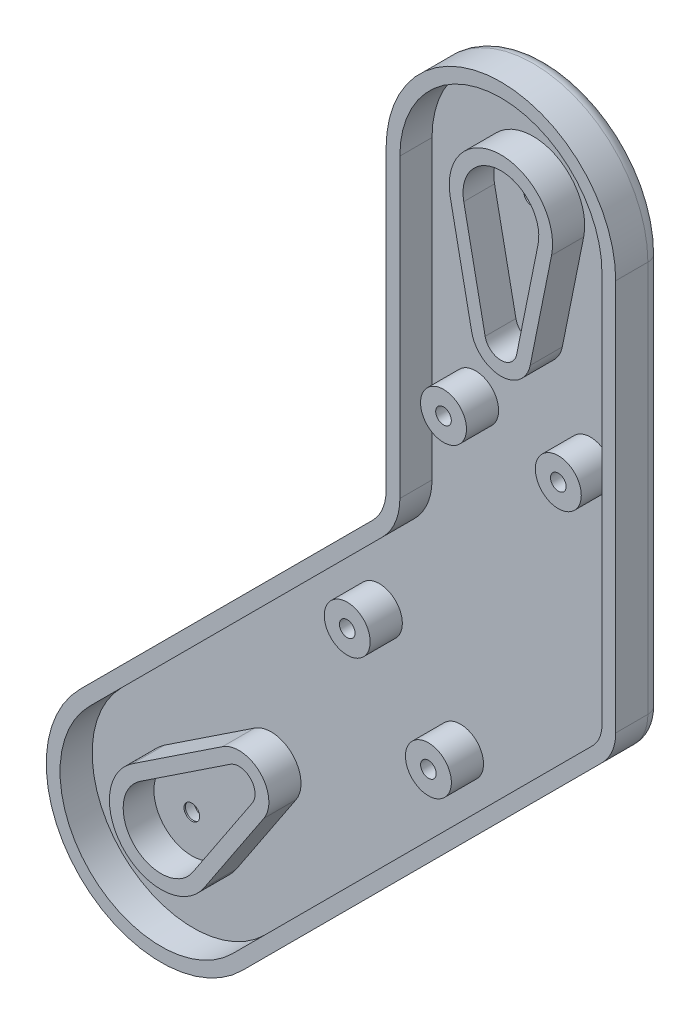
from build123d import *

# Parameters (mm, degrees)
BOSS_EXTRUDE1_DEPTH                          = 10
FILLET1_R                                    = 10
SHELL1_T                                     = -3
FILLET4_R                                    = 3
BOSS_EXTRUDE2_START                          = -3
BOSS_EXTRUDE2_DEPTH                          = 10
BOSS_EXTRUDE6_START                          = -3
BOSS_EXTRUDE6_DEPTH                          = 10
SHELL11_START                                = 3
SHELL11_DEPTH                                = 7
BOSS_EXTRUDE5_DEPTH                          = 3.3
BOSS_EXTRUDE8_DEPTH                          = 3.3
CBORE_FOR_M5_HEX_HEAD_CAP_SCREW4_D           = 3.4
CBORE_FOR_M5_HEX_HEAD_CAP_SCREW4_CBORE_D     = 6.5
CBORE_FOR_M5_HEX_HEAD_CAP_SCREW4_CBORE_DEPTH = 3
SKETCH17_R                                   = 5
BOSS_EXTRUDE4_DEPTH                          = 10
CBORE_FOR_M5_HEX_HEAD_CAP_SCREW3_D           = 3.4
CBORE_FOR_M5_HEX_HEAD_CAP_SCREW3_CBORE_D     = 6.5
CBORE_FOR_M5_HEX_HEAD_CAP_SCREW3_CBORE_DEPTH = 3
CBORE_FOR_M5_HEX_HEAD_CAP_SCREW5_D           = 3.4
CBORE_FOR_M5_HEX_HEAD_CAP_SCREW5_DEPTH       = 5.5
CBORE_FOR_M5_HEX_HEAD_CAP_SCREW5_CBORE_D     = 6.5
CBORE_FOR_M5_HEX_HEAD_CAP_SCREW5_CBORE_DEPTH = 3
CBORE_FOR_M5_HEX_HEAD_CAP_SCREW5_TIP         = 1.021463052


# Read off the part's stored shape, not the designer's step: Shell11
with BuildPart() as part:
    # Sketch1 → Boss-Extrude1 (new body)
    with BuildSketch(Plane.XY):
        with BuildLine():
            Line((17.67766953, -17.67766953), (98.994949366, 63.639610307))
            Line((98.994949366, 63.639610307), (98.994949366, 153.051453663))
            ThreePointArc((98.994949366, 153.051453663), (73.994949366, 178.051453663), (48.994949366, 153.051453663))
            Line((48.994949366, 153.051453663), (48.994949366, 84.350288425))
            Line((48.994949366, 84.350288425), (-17.67766953, 17.67766953))
            ThreePointArc((-17.67766953, 17.67766953), (-17.67766953, -17.67766953), (17.67766953, -17.67766953))
        make_face()
    extrude(amount=BOSS_EXTRUDE1_DEPTH)

    # Fillet1
    fillet1_edges = [part.edges().sort_by_distance(p)[0] for p in [
        (48.994949366, 84.350288425, 5),
        (98.994949366, 63.639610307, 5),
    ]]
    fillet(fillet1_edges, radius=FILLET1_R)

    # Shell1
    shell1_openings = [part.faces().sort_by_distance(p)[0] for p in [
        (50.162308395, 71.072674162, 10),
    ]]
    offset(amount=SHELL1_T, openings=shell1_openings, kind=Kind.INTERSECTION)

    # Fillet4
    fillet4_edges = [part.edges().sort_by_distance(p)[0] for p in [
        (98.994949366, 110.416599797, 0),
        (14.194173824, 49.549512883, 0),
        (98.233744691, 63.954911607, 0),
        (48.233744691, 84.665589726, 0),
        (48.994949366, 120.771938856, 0),
        (73.994949366, 178.051453663, 0),
        (56.871843354, 21.516504294, 0),
        (-17.67766953, -17.67766953, 0),
    ]]
    fillet(fillet4_edges, radius=FILLET4_R)

    # Sketch2 → Boss-Extrude2 (add)
    with BuildSketch(Plane.XY.offset(3).offset(BOSS_EXTRUDE2_START)):
        with BuildLine():
            Line((13.374950088, 22.385502231), (-6.223175758, 9.372010643))
            ThreePointArc((-6.223175758, 9.372010643), (-7.954951288, -7.954951288), (9.372010643, -6.223175758))
            Line((9.372010643, -6.223175758), (22.385502231, 13.374950088))
            ThreePointArc((22.385502231, 13.374950088), (21.566756826, 21.566756826), (13.374950088, 22.385502231))
        make_face()
    extrude(amount=BOSS_EXTRUDE2_DEPTH)

    # Sketch21 → Boss-Extrude6 (add)
    with BuildSketch(Plane.XY.offset(3).offset(BOSS_EXTRUDE6_START)):
        with BuildLine():
            Line((80.366371888, 127.764995329), (85.022411424, 150.824891163))
            ThreePointArc((85.022411424, 150.824891163), (73.994949366, 164.301453663), (62.967487308, 150.824891163))
            Line((62.967487308, 150.824891163), (67.623526844, 127.764995329))
            ThreePointArc((67.623526844, 127.764995329), (73.994949366, 122.551453663), (80.366371888, 127.764995329))
        make_face()
    extrude(amount=BOSS_EXTRUDE6_DEPTH)

    # Shell11 outline → Shell11 (cut)
    with BuildSketch(Plane.XY.offset(SHELL11_START)):
        with BuildLine():
            ThreePointArc((70.564183393, 128.35874533), (73.994949366, 125.551453663), (77.42571534, 128.358745329))
            Line((77.42571534, 128.358745329), (82.081754875, 151.418641163))
            ThreePointArc((82.081754875, 151.418641163), (73.994949366, 161.301453663), (65.908143857, 151.418641163))
            Line((65.908143857, 151.418641163), (70.564183393, 128.35874533))
        make_face()
        with BuildLine():
            Line((15.034463624, 19.886299393), (-4.563662222, 6.872807805))
            ThreePointArc((-4.563662222, 6.872807805), (-5.833630945, -5.833630945), (6.872807805, -4.563662222))
            Line((6.872807805, -4.563662222), (19.886299393, 15.034463624))
            ThreePointArc((19.886299393, 15.034463624), (19.445436483, 19.445436483), (15.034463624, 19.886299393))
        make_face()
    extrude(amount=SHELL11_DEPTH, mode=Mode.SUBTRACT)

    # Sketch18 → Boss-Extrude5 (add)
    with BuildSketch(Plane.XY):
        with BuildLine():
            Line((13.308815704, 22.317827505), (-6.21525525, 9.377265176))
            ThreePointArc((-6.21525525, 9.377265176), (-7.954951288, -7.954951288), (9.377265176, -6.21525525))
            Line((9.377265176, -6.21525525), (22.317827505, 13.308815704))
            ThreePointArc((22.317827505, 13.308815704), (21.496046148, 21.496046148), (13.308815704, 22.317827505))
        make_face()
    extrude(amount=BOSS_EXTRUDE5_DEPTH)

    # Sketch25 → Boss-Extrude8 (add)
    with BuildSketch(Plane.XY):
        with BuildLine():
            Line((80.365282703, 127.859612659), (85.020526295, 150.815575002))
            ThreePointArc((85.020526295, 150.815575002), (73.994949366, 164.301453663), (62.969372437, 150.815575002))
            Line((62.969372437, 150.815575002), (67.624616029, 127.859612659))
            ThreePointArc((67.624616029, 127.859612659), (73.994949366, 122.651453663), (80.365282703, 127.859612659))
        make_face()
    extrude(amount=BOSS_EXTRUDE8_DEPTH)

    # CBORE for M5 Hex Head Cap Screw4 (through all)
    with Locations(Plane(origin=(0, 0, 0), x_dir=(-1, 0, 0), z_dir=(0, 0, -1))):
        with Locations((0, 0), (-16.89985207, 16.89985207)):
            CounterBoreHole(CBORE_FOR_M5_HEX_HEAD_CAP_SCREW4_D / 2, CBORE_FOR_M5_HEX_HEAD_CAP_SCREW4_CBORE_D / 2, CBORE_FOR_M5_HEX_HEAD_CAP_SCREW4_CBORE_DEPTH)

    # Sketch17 → Boss-Extrude4 (add)
    with BuildSketch(Plane.XY):
        with Locations((40.533008589, 58.210678119)):
            Circle(SKETCH17_R)
        with Locations((61.494949366, 108.817279836)):
            Circle(SKETCH17_R)
        with Locations((86.494949366, 108.817279836)):
            Circle(SKETCH17_R)
        with Locations((58.210678119, 40.533008589)):
            Circle(SKETCH17_R)
    extrude(amount=BOSS_EXTRUDE4_DEPTH)

    # CBORE for M5 Hex Head Cap Screw3 (through all)
    with Locations(Plane(origin=(0, 0, 0), x_dir=(-1, 0, 0), z_dir=(0, 0, -1))):
        with Locations((-86.494949366, 108.817279836), (-61.494949366, 108.817279836), (-58.210678119, 40.533008589), (-40.533008589, 58.210678119)):
            CounterBoreHole(CBORE_FOR_M5_HEX_HEAD_CAP_SCREW3_D / 2, CBORE_FOR_M5_HEX_HEAD_CAP_SCREW3_CBORE_D / 2, CBORE_FOR_M5_HEX_HEAD_CAP_SCREW3_CBORE_DEPTH)

    # CBORE for M5 Hex Head Cap Screw5
    with Locations(Plane(origin=(0, 0, 0), x_dir=(-1, 0, 0), z_dir=(0, 0, -1))):
        with Locations((-73.994949366, 153.051453663), (-73.994949366, 129.051453663)):
            CounterBoreHole(CBORE_FOR_M5_HEX_HEAD_CAP_SCREW5_D / 2, CBORE_FOR_M5_HEX_HEAD_CAP_SCREW5_CBORE_D / 2, CBORE_FOR_M5_HEX_HEAD_CAP_SCREW5_CBORE_DEPTH, depth=CBORE_FOR_M5_HEX_HEAD_CAP_SCREW5_DEPTH)
            with Locations((0, 0, -(CBORE_FOR_M5_HEX_HEAD_CAP_SCREW5_DEPTH + CBORE_FOR_M5_HEX_HEAD_CAP_SCREW5_TIP / 2))):  # 118° drill point
                Cone(0, CBORE_FOR_M5_HEX_HEAD_CAP_SCREW5_D / 2, CBORE_FOR_M5_HEX_HEAD_CAP_SCREW5_TIP, mode=Mode.SUBTRACT)


solid = part.part
